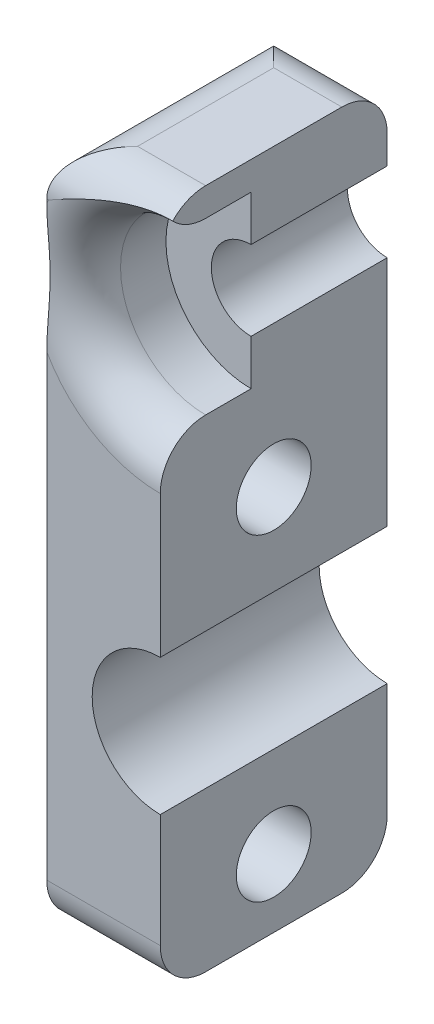
from build123d import *

# Parameters (mm, degrees)
SKETCH_1_W          = 10
SKETCH_1_H          = 20
SKETCH_1_R          = 3
EXTRUDE_1_DEPTH     = 10
SKETCH_2_R          = 1.65
CUT_EXTRUDE_1_DEPTH = 18.320508076
SKETCH_3_W          = 12.852703923
SKETCH_3_H          = 20.2795508
CUT_EXTRUDE_2_DEPTH = 16
EXTRUDE_2_DEPTH     = 10
FILLET_1_R          = 2
SKETCH_6_R          = 3.75
CUT_EXTRUDE_3_DEPTH = 4
FILLET_2_R          = 2


with BuildPart() as part:
    # 草圖1 → 填料-伸長1 (new body)
    with BuildSketch(Plane.XY):
        Rectangle(SKETCH_1_W, SKETCH_1_H)
        Circle(SKETCH_1_R, mode=Mode.SUBTRACT)
    extrude(amount=EXTRUDE_1_DEPTH)

    # 草圖2 → 除料-伸長1 (cut, through all)
    with BuildSketch(Plane.ZY.offset(5)):
        with Locations((5, 7)):
            Circle(SKETCH_2_R)
        with Locations((5, -7)):
            Circle(SKETCH_2_R)
    extrude(amount=-CUT_EXTRUDE_1_DEPTH, mode=Mode.SUBTRACT)

    # 草圖3 → 除料-伸長2 (cut, through all)
    with BuildSketch(Plane.XY.offset(10)):
        with Locations((6.426351961, -0.1397754)):
            Rectangle(SKETCH_3_W, SKETCH_3_H)
    extrude(amount=-CUT_EXTRUDE_2_DEPTH, mode=Mode.SUBTRACT)

    # 草圖5 → 填料-伸長2 (add, through all)
    with BuildSketch(Plane.XY.offset(10)):
        with BuildLine():
            Line((0, 10), (0, 13.25))
            ThreePointArc((0, 13.25), (-1.75, 15), (0, 16.75))
            Line((0, 16.75), (0, 20))
            Line((0, 20), (-5, 20))
            Line((-5, 20), (-5, 10))
            Line((-5, 10), (0, 10))
        make_face()
    extrude(amount=-EXTRUDE_2_DEPTH)

    # 圓角1
    fillet_1_edges = [part.edges().sort_by_distance(p)[0] for p in [
        (-2.5, -10, 0),
        (-2.5, 20, 0),
        (-5, 20, 5),
        (-2.5, 20, 10),
        (-2.5, -10, 10),
    ]]
    fillet(fillet_1_edges, radius=FILLET_1_R)

    # 草圖6 → 除料-伸長3 (cut)
    with BuildSketch(Plane.XY.offset(10)):
        with Locations((0, 15)):
            Circle(SKETCH_6_R)
    extrude(amount=-CUT_EXTRUDE_3_DEPTH, mode=Mode.SUBTRACT)

    # 圓角2
    # the kernel refuses this fillet: 2 mm, written as the material it takes off along each edge
    with BuildSketch(Plane(origin=(0, 15, 10), x_dir=(0.6374525530296073, 0.7704896122830182, 0), z_dir=(0.7704896122830182, -0.6374525530296073, 0))) as fillet_2_piece_1:
        with BuildLine():
            CenterArc((3.75 + FILLET_2_R, -FILLET_2_R), FILLET_2_R, 90, 90)
            Line((3.75, -FILLET_2_R), (3.75, 0))
            Line((3.75, 0), (3.75 + FILLET_2_R, 0))
        make_face()
    revolve(axis=Axis((0, 15, 10), (0, 0, 1)), revolution_arc=296.074145673, mode=Mode.SUBTRACT)


solid = part.part
